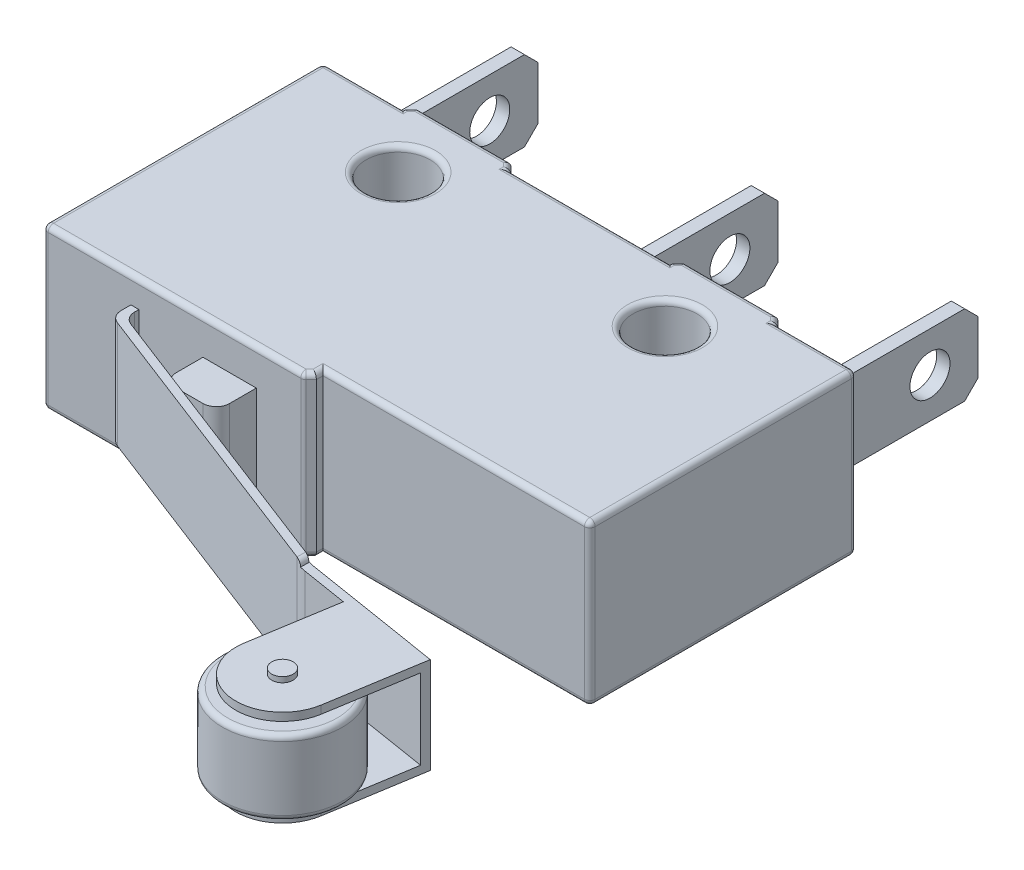
from build123d import *

# Parameters (mm, degrees)
BOSS_EXTRUDE1_DEPTH  = 6
CUT_EXTRUDE1_REACH   = 14.894
SKETCH2_R            = 1.2
BOSS_EXTRUDE2_DEPTH  = 6
FILLET1_R            = 0.2
SKETCH4_W            = 0.5
SKETCH4_H            = 3
BOSS_EXTRUDE3_DEPTH  = 6
CHAMFER1_SIZE        = 0.5
CUT_EXTRUDE2_REACH   = 24.303
SKETCH5_R            = 0.75
SKETCH6_W            = 2
SKETCH6_H            = 3.3
BOSS_EXTRUDE4_DEPTH  = 1.5
FILLET2_R            = 0.5
SKETCH7_W            = 0.3
SKETCH7_H            = 4
BOSS_EXTRUDE5_DEPTH  = 0.5
BOSS_EXTRUDE6_DEPTH  = 4
FILLET3_R            = 0.5
BOSS_EXTRUDE7_DEPTH  = 3.8
CUT_EXTRUDE3_DEPTH   = 0.2
FILLET4_R            = 2
SKETCH11_W           = 3.5
SKETCH11_H           = 0.3
BOSS_EXTRUDE8_DEPTH  = 5
CUT_EXTRUDE4_START   = -3.6
CUT_EXTRUDE4_DEPTH   = 3.6
SKETCH13_R           = 2.25
BOSS_EXTRUDE9_DEPTH  = 2.9
CUT_EXTRUDE5_REACH   = 28.865
SKETCH14_W           = 5.5
SKETCH14_H           = 0.1
FILLET6_R            = 0.2
SKETCH15_R           = 0.4
BOSS_EXTRUDE10_DEPTH = 0.2
SKETCH16_R           = 0.4
BOSS_EXTRUDE11_DEPTH = 4
FILLET7_R            = 0.2


# Some blends are built 0.0001 mm under size
with BuildPart() as part:
    # Sketch1 → Boss-Extrude1 (new body)
    with BuildSketch(Plane(origin=(0, 0, 0), x_dir=(1, 0, 0), z_dir=(0, 1, 0))):
        Polygon((-10, 5), (10, 5), (10, -5), (0, -5), (0, -5.25), (-0.25, -5.5), (-10, -5.5), (-10, -5), align=None)
    extrude(amount=BOSS_EXTRUDE1_DEPTH)

    # Sketch2 → Cut-Extrude1 (cut, up to next)
    with BuildSketch(Plane.XZ, mode=Mode.PRIVATE) as cut_extrude1_sk1:
        with Locations(Location((-5, -2.817398743, 0), (0, 0, 270))):
            Circle(SKETCH2_R)
    cut_extrude1_tool1 = extrude(cut_extrude1_sk1.sketch, amount=-CUT_EXTRUDE1_REACH, mode=Mode.PRIVATE) & part.part
    # Sketch2 → Cut-Extrude1 (cut, up to next)
    with BuildSketch(Plane.XZ, mode=Mode.PRIVATE) as cut_extrude1_sk2:
        with Locations(Location((5, -2.817398743, 0), (0, 0, 270))):
            Circle(SKETCH2_R)
    cut_extrude1_tool2 = extrude(cut_extrude1_sk2.sketch, amount=-CUT_EXTRUDE1_REACH, mode=Mode.PRIVATE) & part.part
    add(cut_extrude1_tool1.solids().sort_by_distance((-5, 0, -2.817399))[0], mode=Mode.SUBTRACT)
    add(cut_extrude1_tool2.solids().sort_by_distance((5, 0, -2.817399))[0], mode=Mode.SUBTRACT)

    # Sketch3 → Boss-Extrude2 (add)
    with BuildSketch(Plane.XZ):
        Polygon((5, -5.3), (6.75, -5.3), (7, -5.05), (7, -5), (3, -5), (3, -5.05), (3.25, -5.3), align=None)
        Polygon((-6.75, -5.3), (-7, -5.05), (-7, -5), (-3, -5), (-3, -5.05), (-3.25, -5.3), (-5, -5.3), align=None)
    extrude(amount=-BOSS_EXTRUDE2_DEPTH)

    # Fillet1
    fillet1_edges = [part.edges().sort_by_distance(p)[0] for p in [
        (10, 3, 5),
        (10, 3, -5),
        (-10, 3, 5.5),
        (-0.25, 3, 5.5),
        (-5.125, 0, 5.5),
        (-5.125, 6, 5.5),
        (-0.125, 0, 5.375),
        (-0.125, 6, 5.375),
        (0, 0, 5.125),
        (0, 6, 5.125),
        (5, 0, 5),
        (5, 6, 5),
        (10, 0, 0),
        (10, 6, 0),
        (8.5, 6, -5),
        (8.5, 0, -5),
        (7, 6, -5.025),
        (7, 0, -5.025),
        (6.875, 6, -5.175),
        (6.875, 0, -5.175),
        (5, 6, -5.3),
        (5, 0, -5.3),
        (3.125, 6, -5.175),
        (3.125, 0, -5.175),
        (3, 6, -5.025),
        (3, 0, -5.025),
        (0, 6, -5),
        (0, 0, -5),
        (-3, 6, -5.025),
        (-3, 0, -5.025),
        (-3.125, 6, -5.175),
        (-3.125, 0, -5.175),
        (-5, 6, -5.3),
        (-5, 0, -5.3),
        (-6.875, 6, -5.175),
        (-6.875, 0, -5.175),
        (-7, 6, -5.025),
        (-7, 0, -5.025),
        (-8.5, 6, -5),
        (-8.5, 0, -5),
        (-10, 0, 0.25),
        (-10, 6, 0.25),
        (-5, 0, -1.617398743),
        (-5, 6, -1.617398743),
        (5, 0, -1.617398743),
        (5, 6, -1.617398743),
        (-10, 3, -5),
    ]]
    fillet(fillet1_edges, radius=FILLET1_R)

    # Sketch4 → Boss-Extrude3 (add)
    with BuildSketch(Plane(origin=(0, 0, -5), x_dir=(-1, 0, 0), z_dir=(0, 0, -1))):
        with Locations((8.2, 3)):
            Rectangle(SKETCH4_W, SKETCH4_H)
        with Locations((-0.8, 3)):
            Rectangle(SKETCH4_W, SKETCH4_H)
        with Locations((-8.3, 3)):
            Rectangle(SKETCH4_W, SKETCH4_H)
    extrude(amount=BOSS_EXTRUDE3_DEPTH)

    # Chamfer1
    chamfer1_edges = [part.edges().sort_by_distance(p)[0] for p in [
        (-8.2, 4.5, -11),
        (-8.2, 1.5, -11),
        (0.8, 4.5, -11),
        (0.8, 1.5, -11),
        (8.3, 4.5, -11),
        (8.3, 1.5, -11),
    ]]
    chamfer(chamfer1_edges, length=CHAMFER1_SIZE)

    # Cut-Extrude2: up to this face of the body (flat: up to its plane)
    cut_extrude2_end = Plane(part.part.faces().sort_by_distance((8.55, 3, -7.960093897))[0])
    # Sketch5 → Cut-Extrude2 (cut, up to the picked face)
    with BuildSketch(Plane.ZY.offset(8.45), mode=Mode.PRIVATE) as cut_extrude2_sk1:
        with Locations(Location((-9.2, 3, 0), (0, 0, 270))):
            Circle(SKETCH5_R)
    cut_extrude2_tool1 = split(extrude(cut_extrude2_sk1.sketch, amount=-CUT_EXTRUDE2_REACH, mode=Mode.PRIVATE), bisect_by=cut_extrude2_end, keep=Keep.BOTH, mode=Mode.PRIVATE)
    add(cut_extrude2_tool1.solids().sort_by(Axis((-8.45, 3, -9.2), (1, 0, 0)))[0], mode=Mode.SUBTRACT)

    # Sketch6 → Boss-Extrude4 (add)
    with BuildSketch(Plane.XY.offset(5.5)):
        with Locations((-3, 3)):
            Rectangle(SKETCH6_W, SKETCH6_H)
    extrude(amount=BOSS_EXTRUDE4_DEPTH)

    # Fillet2
    fillet2_edges = [part.edges().sort_by_distance(p)[0] for p in [
        (-2, 3, 7),
        (-4, 3, 7),
    ]]
    fillet(fillet2_edges, radius=FILLET2_R)

    # Sketch7 → Boss-Extrude5 (add)
    with BuildSketch(Plane.XY.offset(5.5)):
        with Locations((-6.55, 3)):
            Rectangle(SKETCH7_W, SKETCH7_H)
    extrude(amount=BOSS_EXTRUDE5_DEPTH)

    # Sketch8 → Boss-Extrude6 (add)
    with BuildSketch(Plane.XZ.offset(-1)):
        Polygon((-6.4, 6), (4.794322988, 10.322861649), (4.794322988, 10.644453227), (-6.7, 6.20574192), (-6.7, 6), align=None)
    extrude(amount=-BOSS_EXTRUDE6_DEPTH)

    # Fillet3
    fillet3_edges = [part.edges().sort_by_distance(p)[0] for p in [
        (-6.4, 3, 6),
        (-6.7, 3, 6.20574192),
    ]]
    fillet(fillet3_edges, radius=FILLET3_R)

    # Sketch9 → Boss-Extrude7 (add)
    with BuildSketch(Plane.XZ.offset(-1)):
        Polygon((4.794322988, 10.322861649), (10.22344725, 11.202980817), (10.17264879, 11.516337421), (4.794322988, 10.644453227), align=None)
    extrude(amount=-BOSS_EXTRUDE7_DEPTH)

    # Sketch10 → Cut-Extrude3 (cut)
    with BuildSketch(Plane.XZ.offset(-1)):
        Polygon((10.22344725, 11.202980817), (10.17264879, 11.516337421), (4.794322988, 10.644453227), (4.794322988, 10.322861649), (4.845121449, 10.331096623), align=None)
    extrude(amount=-CUT_EXTRUDE3_DEPTH, mode=Mode.SUBTRACT)

    # Fillet4
    # the kernel refuses this fillet: 2 mm, written as the material it adds along each edge
    with BuildSketch(Plane(origin=(4.794322988, 1.2, 10.322861649), x_dir=(-0.9328602490176614, 0, -0.3602384707422385), z_dir=(0, 1, 0))) as fillet4_piece_1:
        with BuildLine():
            CenterArc((FILLET4_R * 0.104281010979, -FILLET4_R), FILLET4_R, 90, 11.906688199)
            Line((-FILLET4_R * 0.102037395433, -FILLET4_R * 0.0215150920042), (0, 0))
            Line((0, 0), (FILLET4_R * 0.104281010979, 0))
        make_face()
    extrude(amount=3.6)
    # the kernel refuses this fillet: 2 mm, written as the material it takes off along each edge
    with BuildSketch(Plane(origin=(4.794322988, 0.678594945, 10.644453227), x_dir=(-0.9328602490176592, 0, -0.36023847074224447), z_dir=(0, 1, 0))) as fillet4_2_piece_1:
        with BuildLine():
            CenterArc((FILLET4_R * 0.104281010979, -FILLET4_R), FILLET4_R, 90, 11.906688199)
            Line((-FILLET4_R * 0.102037395433, -FILLET4_R * 0.0215150920042), (0, 0))
            Line((0, 0), (FILLET4_R * 0.104281010979, 0))
        make_face()
    extrude(amount=4.64281011, mode=Mode.SUBTRACT)

    # Sketch11 → Boss-Extrude8 (add)
    with BuildSketch(Plane(origin=(-1.558625109, 0, 9.614572325), x_dir=(0.9871135021449107, 0, 0.16002166691798186), z_dir=(-0.16002166691798186, 0, 0.9871135021449108))):
        with Locations((10.134422484, 1.35)):
            Rectangle(SKETCH11_W, SKETCH11_H)
        with Locations((10.134422484, 4.65)):
            Rectangle(SKETCH11_W, SKETCH11_H)
    extrude(amount=BOSS_EXTRUDE8_DEPTH)

    # Sketch12 → Cut-Extrude4 (cut)
    with BuildSketch(Plane.XZ.offset(-1.2).offset(CUT_EXTRUDE4_START)):
        with BuildLine():
            ThreePointArc((6.197681115, 14.164380469), (6.505622394, 15.467892315), (7.645091826, 16.171867015))
            Line((7.645091826, 16.171867015), (5.917643198, 15.891829098))
            Line((5.917643198, 15.891829098), (6.197681115, 14.164380469))
        make_face()
        with BuildLine():
            Line((9.372540455, 16.451904932), (7.645091826, 16.171867015))
            ThreePointArc((7.645091826, 16.171867015), (8.948603673, 15.863925736), (9.652578372, 14.724456303))
            Line((9.652578372, 14.724456303), (9.372540455, 16.451904932))
        make_face()
    extrude(amount=CUT_EXTRUDE4_DEPTH, mode=Mode.SUBTRACT)

    # Sketch13 → Boss-Extrude9 (add)
    with BuildSketch(Plane(origin=(0, 1.5, 0), x_dir=(1, 0, 0), z_dir=(0, 1, 0))):
        with Locations(Location((7.925129743, -14.444418386, 0), (0, 0, 29.73428742))):
            Circle(SKETCH13_R)
    extrude(amount=BOSS_EXTRUDE9_DEPTH)

    # Sketch14 → Cut-Extrude5 (cut, up to next)
    with BuildSketch(Plane(origin=(10.175129743, 0, 0), x_dir=(0, 0, -1), z_dir=(1, 0, 0)), mode=Mode.PRIVATE) as cut_extrude5_sk1:
        with Locations((-14.577965265, 1.55)):
            Rectangle(SKETCH14_W, SKETCH14_H)
    cut_extrude5_tool1 = extrude(cut_extrude5_sk1.sketch, amount=-CUT_EXTRUDE5_REACH, mode=Mode.PRIVATE) & part.part
    add(cut_extrude5_tool1.solids().sort_by_distance((10.17513, 1.55, 14.577965))[0], mode=Mode.SUBTRACT)


with BuildPart() as cut_extrude5_piece_1:
    # of the separate pieces the step leaves, piece 1, a body of its own (cut_extrude5_pieces)
    add(part.part.solids().sort_by_distance((4.599763768, 1.2, 10.247729585))[0])

    # Sketch15 → Boss-Extrude10 (add)
    with BuildSketch(Plane.XZ.offset(-1.2)):
        with Locations(Location((7.925129743, 14.444418386, 0), (0, 0, 270))):
            Circle(SKETCH15_R)
    extrude(amount=BOSS_EXTRUDE10_DEPTH)



with BuildPart() as cut_extrude5_piece_2:
    # of the separate pieces the step leaves, piece 2, a body of its own (cut_extrude5_pieces)
    add(part.part.solids().sort_by_distance((9.878883184, 1.6, 13.328467001))[0])

    # Fillet6
    fillet6_edges = [cut_extrude5_piece_2.edges().sort_by_distance(p)[0] for p in [
        (5.971376303, 4.4, 15.560369771),
        (5.971376303, 1.6, 15.560369771),
    ]]
    fillet(fillet6_edges, radius=FILLET6_R)


with BuildPart() as cut_extrude5_piece_1_1:
    add(cut_extrude5_piece_1.part)

    add(cut_extrude5_piece_2.part)  # Boss-Extrude11 merges Cut-Extrude5 piece 2
    # Sketch16 → Boss-Extrude11 (add)
    with BuildSketch(Plane.XZ.offset(-1)):
        with Locations((7.925129743, 14.444418386)):
            Circle(SKETCH16_R)
    extrude(amount=-BOSS_EXTRUDE11_DEPTH)

    # Fillet7
    fillet7_edges = [cut_extrude5_piece_1_1.edges().sort_by_distance(p)[0] for p in [
        (4.794322988, 5, 10.478038204),
        (4.794322988, 1, 10.478038204),
    ]]
    fillet(fillet7_edges, radius=FILLET7_R - 0.0001)  # a hair under: the kernel refuses the full size


solid = cut_extrude5_piece_1_1.part
